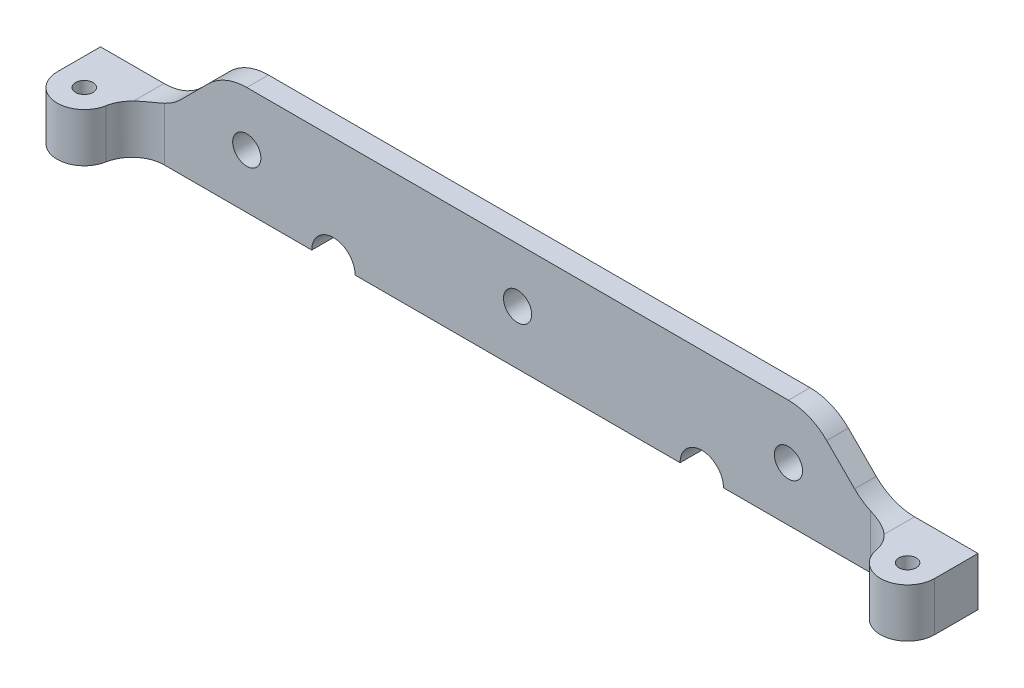
from build123d import *
from build123d.topology import SkipClean

# Parameters (mm, degrees)
SKETCH1_R           = 1.6
BOSS_EXTRUDE1_DEPTH = 20
SKETCH3_R           = 2.6
BOSS_EXTRUDE2_DEPTH = 13


with BuildPart() as part:
    # Sketch1 → Boss-Extrude1 (new body)
    with BuildSketch(Plane(origin=(0, 0, 0), x_dir=(1, 0, 0), z_dir=(0, 1, 0))):
        with BuildLine():
            Line((165, -8), (165, 0))
            Line((165, 0), (84, 0))
            Line((84, 0), (84, -4))
            Line((84, -4), (149.183346174, -4))
            ThreePointArc((149.183346174, -4), (153.020959068, -5.387763311), (155.08333917, -8.909090909))
            ThreePointArc((155.08333917, -8.909090909), (160.456451448, -12.979121617), (165, -8))
        make_face()
        with Locations(Location((160, -8, 0), (0, 0, 270))):
            Circle(SKETCH1_R, mode=Mode.SUBTRACT)
    extrude(amount=BOSS_EXTRUDE1_DEPTH)


with BuildPart() as body_2:
    # Sketch3 → Boss-Extrude2 (new, through all)
    with BuildSketch(Plane.XY):
        with BuildLine():
            Line((122, 0), (165, 0))
            Line((165, 0), (165, 9))
            Line((165, 9), (153.284271247, 9))
            ThreePointArc((153.284271247, 9), (149.457436924, 9.761204675), (146.213203436, 11.928932188))
            Line((146.213203436, 11.928932188), (141.071067812, 17.071067812))
            ThreePointArc((141.071067812, 17.071067812), (137.826834324, 19.238795325), (134, 20))
            Line((134, 20), (84, 20))
            Line((84, 20), (84, 12.6))
            ThreePointArc((84, 12.6), (85.838477631, 11.838477631), (86.6, 10))
            ThreePointArc((86.6, 10), (85.838477631, 8.161522369), (84, 7.4))
            Line((84, 7.4), (84, 0))
            Line((84, 0), (114, 0))
            ThreePointArc((114, 0), (118, 4), (122, 0))
        make_face()
        with Locations(Location((134, 10, 0), (0, 0, 180))):
            Circle(SKETCH3_R, mode=Mode.SUBTRACT)
    extrude(amount=BOSS_EXTRUDE2_DEPTH)

    # Intersect1: read off the stored shape, not the designer's step
    # Intersect1: intersect part
    add(part.part, mode=Mode.INTERSECT)

    # Mirror1: body 2 across face


with BuildPart() as body_2_1:
    with SkipClean():  # the faces are left unmerged after this step: merging them gives an invalid solid
        add(body_2.part)
        add(body_2.part.mirror(Plane(origin=(84, 16.3, 2), x_dir=(0, 0, 1), z_dir=(-1, 0, 0))))


solid = body_2_1.part
